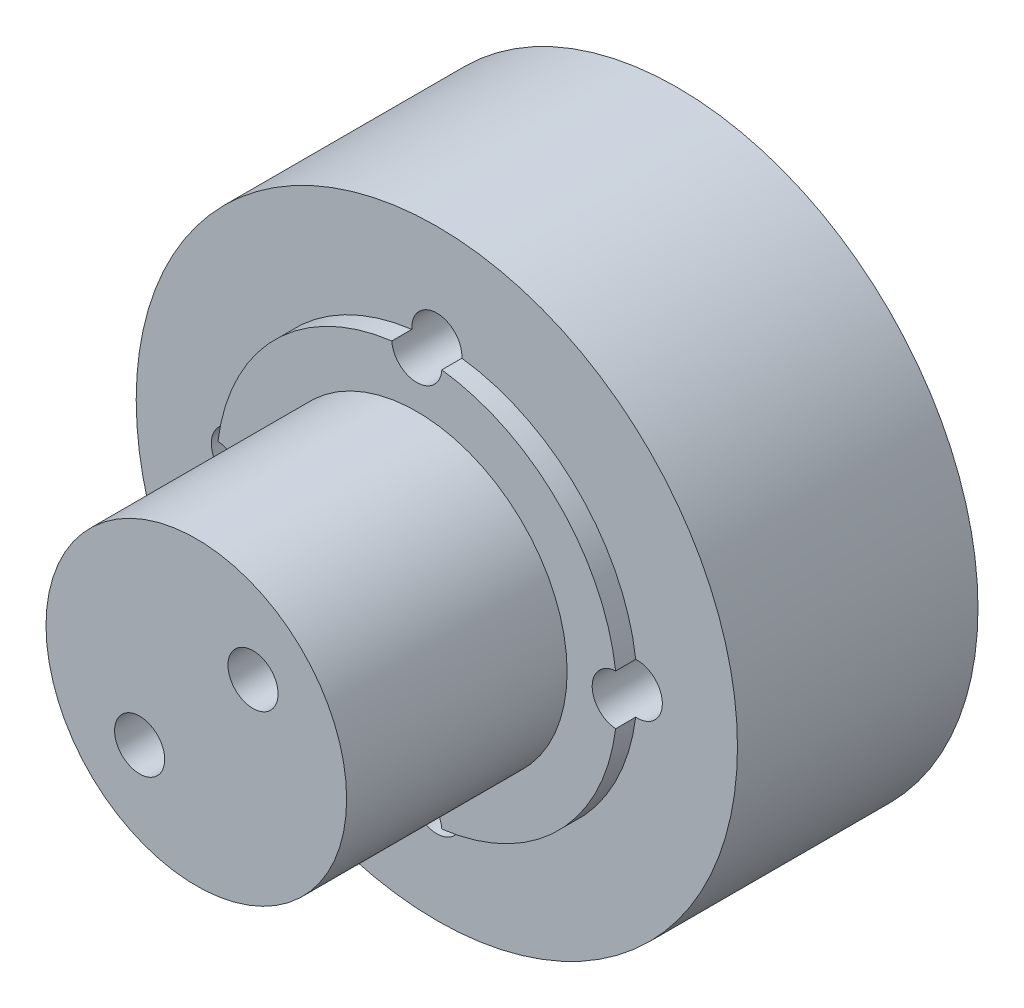
from build123d import *

# Parameters (mm, degrees)
SKETCH_1_R      = 15
EXTRUDE_1_DEPTH = 12
SKETCH_2_R      = 10
EXTRUDE_2_DEPTH = 1
SKETCH_3_R      = 7.5
EXTRUDE_3_DEPTH = 11
M3X0_52_D       = 2.5
M3X0_51_D       = 2.5
M3X0_51_DEPTH   = 8
M3X0_51_TIP     = 0.751075774


with BuildPart() as part:
    # Эскиз1 → Бобышка-Вытянуть1 (new body)
    with BuildSketch(Plane.XY):
        Circle(SKETCH_1_R)
    extrude(amount=EXTRUDE_1_DEPTH)

    # Эскиз2 → Бобышка-Вытянуть2 (add)
    with BuildSketch(Plane.XY.offset(12)):
        Circle(SKETCH_2_R)
    extrude(amount=EXTRUDE_2_DEPTH)

    # Эскиз3 → Бобышка-Вытянуть3 (add)
    with BuildSketch(Plane.XY.offset(13)):
        Circle(SKETCH_3_R)
    extrude(amount=EXTRUDE_3_DEPTH)

    # Отверстие обработанное метчиком M3x0.52 (through all)
    with Locations(Plane(origin=(0, 0, 0), x_dir=(-1, 0, 0), z_dir=(0, 0, -1))):
        with Locations((0, 10), (10, 0), (-10, 0), (0, -10)):
            Hole(M3X0_52_D / 2)

    # Отверстие обработанное метчиком M3x0.51
    with Locations(Plane.XY.offset(24)):
        with Locations((-2.828427125, -2.828427125), (2.828427125, 2.828427125)):
            Hole(M3X0_51_D / 2, depth=M3X0_51_DEPTH)
            with Locations((0, 0, -(M3X0_51_DEPTH + M3X0_51_TIP / 2))):  # 118° drill point
                Cone(0, M3X0_51_D / 2, M3X0_51_TIP, mode=Mode.SUBTRACT)


solid = part.part
